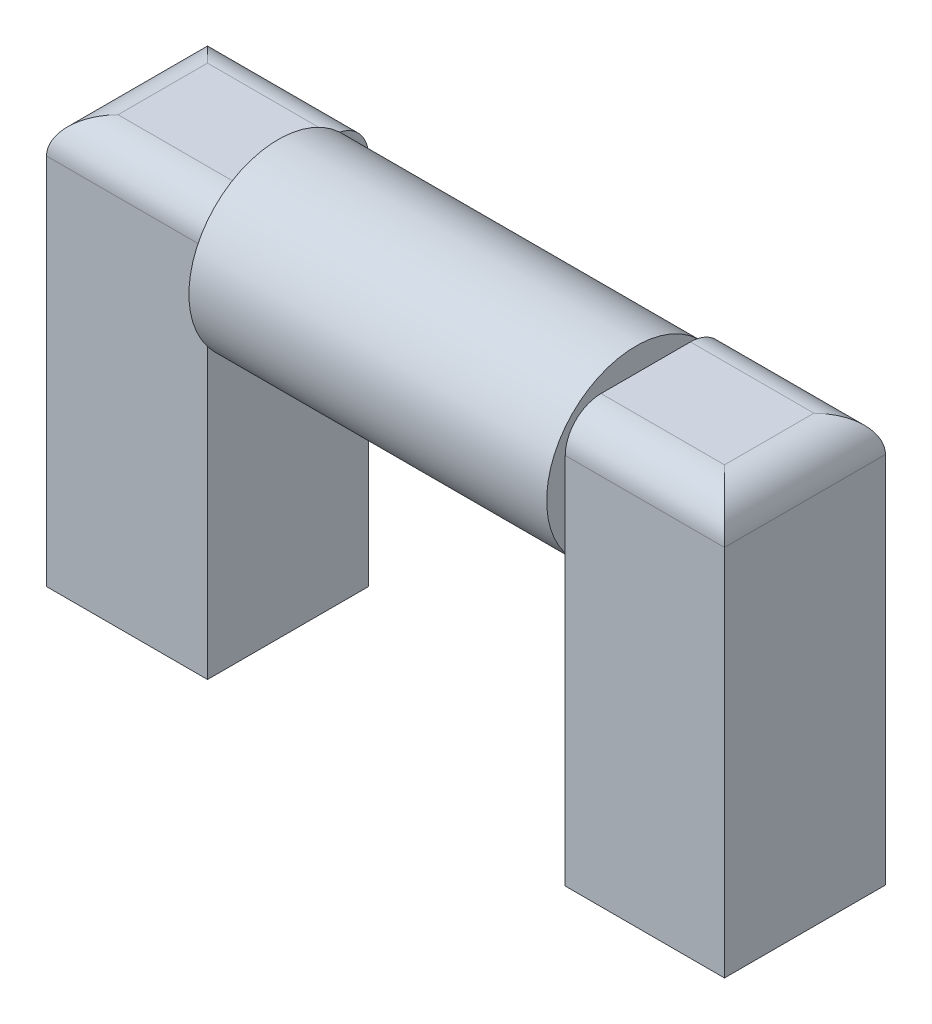
from build123d import *

# Parameters (mm, degrees)
SKIZZE1_W                         = 4.5
SKIZZE1_H                         = 11.423295
AUFSATZ_LINEAR_AUSTRAGEN1_DEPTH   = 4.5
SKIZZE1_W_2                       = 4.451373
AUFSATZ_LINEAR_AUSTRAGEN1_2_DEPTH = 4.5
SKIZZE2_R                         = 2.5
AUFSATZ_LINEAR_AUSTRAGEN2_DEPTH   = 10
VERRUNDUNG4_R                     = 1


with BuildPart() as part:
    # Skizze1 → Aufsatz-Linear austragen1 (new body)
    with BuildSketch(Plane.XY):
        with Locations((-2.25, 5.7116475)):
            Rectangle(SKIZZE1_W, SKIZZE1_H)
    extrude(amount=AUFSATZ_LINEAR_AUSTRAGEN1_DEPTH)



with BuildPart() as body_2:
    # Skizze1 → Aufsatz-Linear austragen1 2 (new body)
    with BuildSketch(Plane.XY):
        with Locations((12.2256865, 5.7116475)):
            Rectangle(SKIZZE1_W_2, SKIZZE1_H)
    extrude(amount=AUFSATZ_LINEAR_AUSTRAGEN1_2_DEPTH)


with BuildPart() as part_1:
    add(part.part)

    add(body_2.part)  # Aufsatz-Linear austragen2 merges body 2
    # Skizze2 → Aufsatz-Linear austragen2 (add)
    with BuildSketch(Plane(origin=(0, 0, 0), x_dir=(0, 0, -1), z_dir=(1, 0, 0))):
        with Locations(Location((-2.520313205, 9.586549386, 0), (0, 0, 217.638946457))):
            Circle(SKIZZE2_R)
    extrude(amount=AUFSATZ_LINEAR_AUSTRAGEN2_DEPTH)

    # Verrundung4
    # the kernel refuses this fillet: 1 mm, written as the material it takes off along each edge
    with BuildSketch(Plane(origin=(16.951373, 11.423295, 0), x_dir=(0, 0, 1), z_dir=(-1, 0, 0)), Plane(origin=(16.951373, 11.423295, 4.5), x_dir=(0, -1, 0), z_dir=(-1, 0, 0))) as verrundung4_piece_1:
        with BuildLine():
            CenterArc((VERRUNDUNG4_R, -VERRUNDUNG4_R), VERRUNDUNG4_R, 90, 90)
            Line((0, -VERRUNDUNG4_R), (0, 0))
            Line((0, 0), (VERRUNDUNG4_R, 0))
        make_face()
    extrude(amount=6.951373, mode=Mode.SUBTRACT)
    with BuildSketch(Plane(origin=(14.451373, 11.423295, -2.5), x_dir=(-1, 0, 0), z_dir=(0, 0, 1)), Plane(origin=(-4.5, 11.423295, -2.5), x_dir=(0, -1, 0), z_dir=(0, 0, 1))) as verrundung4_piece_2:
        with BuildLine():
            CenterArc((VERRUNDUNG4_R, VERRUNDUNG4_R), VERRUNDUNG4_R, 180, 90)
            Line((0, VERRUNDUNG4_R), (0, 0))
            Line((0, 0), (VERRUNDUNG4_R, 0))
        make_face()
    extrude(amount=9.5, mode=Mode.SUBTRACT)
    with BuildSketch(Plane(origin=(-7, 11.423295, 0), x_dir=(0, -1, 0), z_dir=(1, 0, 0))) as verrundung4_piece_3:
        with BuildLine():
            CenterArc((VERRUNDUNG4_R, -VERRUNDUNG4_R), VERRUNDUNG4_R, 90, 90)
            Line((0, -VERRUNDUNG4_R), (0, 0))
            Line((0, 0), (VERRUNDUNG4_R, 0))
        make_face()
    extrude(amount=7, mode=Mode.SUBTRACT)
    with BuildSketch(Plane(origin=(-7, 11.423295, 4.5), x_dir=(0, -1, 0), z_dir=(1, 0, 0))) as verrundung4_piece_4:
        with BuildLine():
            CenterArc((VERRUNDUNG4_R, VERRUNDUNG4_R), VERRUNDUNG4_R, 180, 90)
            Line((0, VERRUNDUNG4_R), (0, 0))
            Line((0, 0), (VERRUNDUNG4_R, 0))
        make_face()
    extrude(amount=7, mode=Mode.SUBTRACT)


solid = part_1.part
